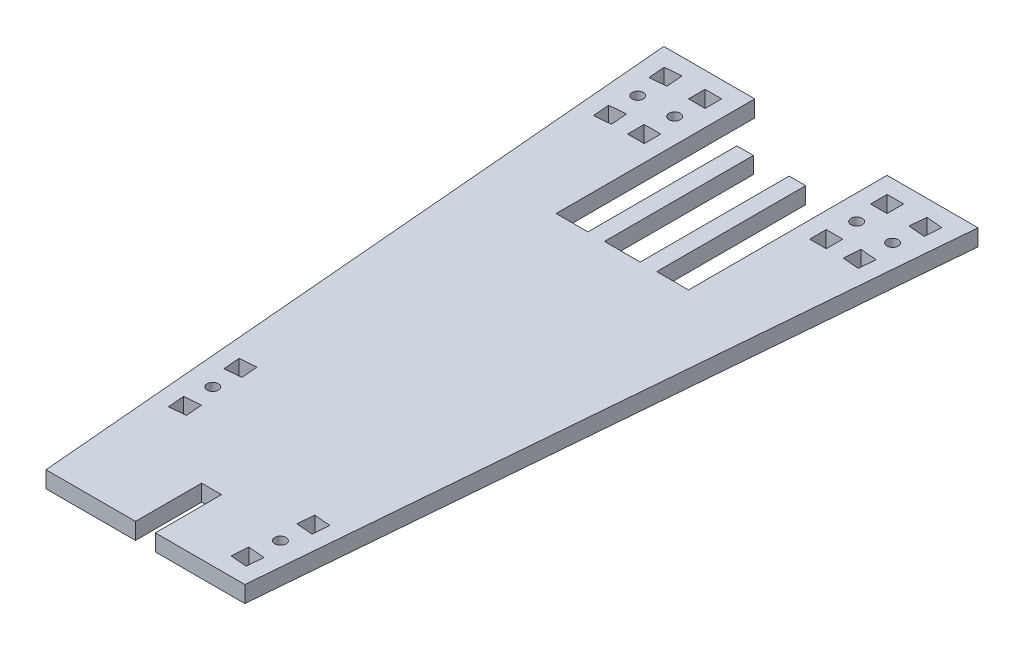
from build123d import *

# Parameters (mm, degrees)
SKETCH1_R           = 2.159
SKETCH1_W           = 6.35
SKETCH1_H           = 6.35
BOSS_EXTRUDE1_DEPTH = 6.35


with BuildPart() as part:
    # Sketch1 → Boss-Extrude1 (new body)
    with BuildSketch(Plane(origin=(0, 0, 0), x_dir=(1, 0, 0), z_dir=(0, 1, 0))):
        Polygon((-25.4, 76.2), (-47.529212827, 76.2), (-60.275410472, 76.2), (-38.146197645, -183.007951216), (-25.4, -183.007951216), (-3.81, -183.007951216), (-3.81, -157.607951216), (3.81, -157.607951216), (3.81, -183.007951216), (25.4, -183.007951216), (38.146197645, -183.007951216), (60.275410472, 76.2), (47.529212827, 76.2), (25.4, 76.2), (25.4, 0), (13.208, 0), (13.208, 57.15), (6.858, 57.15), (6.858, 0), (-6.858, 0), (-6.858, 57.15), (-13.208, 57.15), (-13.208, 0), (-25.4, 0), align=None)
        Polygon((-35.565938508, -138.580966319), (-36.106088587, -132.253981421), (-29.779103689, -131.713831342), (-29.23895361, -138.04081624), align=None, mode=Mode.SUBTRACT)
        with Locations((-33.666397244, -123.505746619)):
            Circle(SKETCH1_R, mode=Mode.SUBTRACT)
        Polygon((-31.76685598, -108.43052692), (-31.226705901, -114.757511817), (-37.553690799, -115.297661896), (-38.093840878, -108.970676999), align=None, mode=Mode.SUBTRACT)
        Polygon((26.526414083, -169.813831342), (32.853398981, -170.353981421), (32.313248902, -176.680966319), (25.986264004, -176.14081624), align=None, mode=Mode.SUBTRACT)
        with Locations((30.413707638, -161.605746619)):
            Circle(SKETCH1_R, mode=Mode.SUBTRACT)
        Polygon((34.301001193, -153.397661896), (27.974016295, -152.857511817), (28.514166374, -146.53052692), (34.841151272, -147.070676999), align=None, mode=Mode.SUBTRACT)
        Polygon((-50.788145275, 39.722575704), (-51.328295354, 46.049560601), (-45.001310457, 46.58971068), (-44.461160378, 40.262725783), align=None, mode=Mode.SUBTRACT)
        with Locations((-34.925, 43.307)):
            Rectangle(SKETCH1_W, SKETCH1_H, mode=Mode.SUBTRACT)
        with Locations((-48.888604012, 54.797795403)):
            Circle(SKETCH1_R, mode=Mode.SUBTRACT)
        Polygon((-46.989062748, 69.873015103), (-46.448912669, 63.546030205), (-52.775897566, 63.005880126), (-53.316047645, 69.332865024), align=None, mode=Mode.SUBTRACT)
        with Locations((-34.925, 54.991)):
            Circle(SKETCH1_R, mode=Mode.SUBTRACT)
        with Locations((-34.925, 66.675)):
            Rectangle(SKETCH1_W, SKETCH1_H, mode=Mode.SUBTRACT)
        with Locations((34.925, 43.307)):
            Rectangle(SKETCH1_W, SKETCH1_H, mode=Mode.SUBTRACT)
        Polygon((45.001310457, 46.58971068), (51.328295354, 46.049560601), (50.788145275, 39.722575704), (44.461160378, 40.262725783), align=None, mode=Mode.SUBTRACT)
        with Locations((34.925, 54.991)):
            Circle(SKETCH1_R, mode=Mode.SUBTRACT)
        with Locations((34.925, 66.675)):
            Rectangle(SKETCH1_W, SKETCH1_H, mode=Mode.SUBTRACT)
        with Locations((48.888604012, 54.797795403)):
            Circle(SKETCH1_R, mode=Mode.SUBTRACT)
        Polygon((52.775897566, 63.005880126), (46.448912669, 63.546030205), (46.989062748, 69.873015103), (53.316047645, 69.332865024), align=None, mode=Mode.SUBTRACT)
    extrude(amount=BOSS_EXTRUDE1_DEPTH)


solid = part.part
